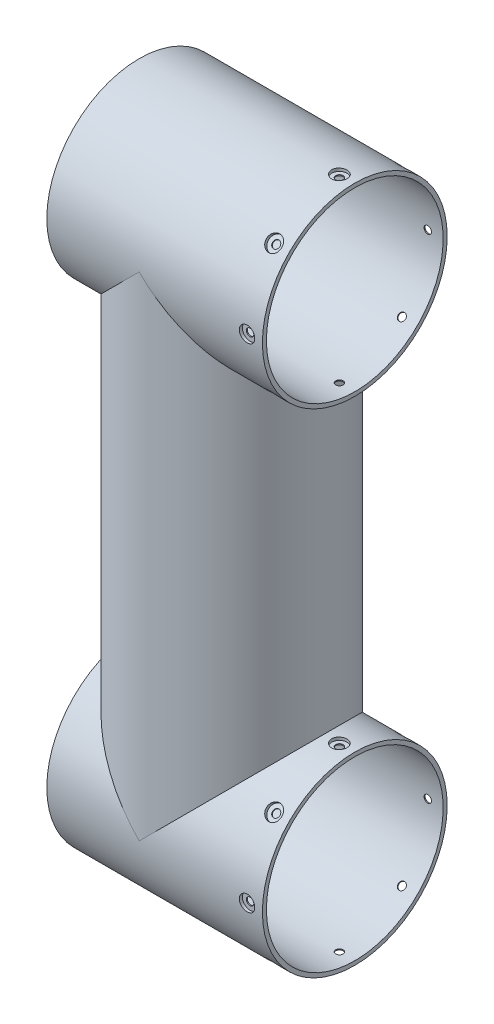
from build123d import *
from build123d.topology import SkipClean

# Parameters (mm, degrees)
SKETCH_1_R               = 30
EXTRUDE_1_DEPTH          = 160
EXTRUDE_START            = -30
SKETCH_2_R               = 30
EXTRUDE_2_DEPTH          = 70
SKETCH_3_R               = 28.7
CUT_EXTRUDE_1_DEPTH      = 178.200451467
SKETCH_4_R               = 28.7
CUT_EXTRUDE_2_DEPTH      = 160
PATTERN_CIRCULAR_1_COUNT = 8


with BuildPart() as part:
    # 스케치1 → 보스-돌출1 (new body)
    with BuildSketch(Plane(origin=(0, 0, 0), x_dir=(1, 0, 0), z_dir=(0, 1, 0))):
        Circle(SKETCH_1_R)
    extrude(amount=EXTRUDE_1_DEPTH)

    # 스케치2 → 보스-돌출2 (add)
    with SkipClean():  # the faces are left unmerged after this step: merging them gives an invalid solid
        with BuildSketch(Plane(origin=(0, 0, 0), x_dir=(0, 0, -1), z_dir=(1, 0, 0)).offset(EXTRUDE_START)):
            Circle(SKETCH_2_R)
        extrude_2 = extrude(amount=EXTRUDE_2_DEPTH)

    # 스케치3 → 컷-돌출1 (cut, through all)
    with SkipClean():  # the faces are left unmerged after this step: merging them gives an invalid solid
        with BuildSketch(Plane.ZY.offset(30)):
            Circle(SKETCH_3_R)
        cut_extrude_1 = extrude(amount=-CUT_EXTRUDE_1_DEPTH, mode=Mode.SUBTRACT)

    # 스케치4 → 컷-돌출2 (cut)
    with SkipClean():  # the faces are left unmerged after this step: merging them gives an invalid solid
        with BuildSketch(Plane(origin=(0, 160, 0), x_dir=(1, 0, 0), z_dir=(0, 1, 0))):
            Circle(SKETCH_4_R)
        extrude(amount=-CUT_EXTRUDE_2_DEPTH, mode=Mode.SUBTRACT)

    # 스케치7 → M2 남비 머리 나사용 카운터보어1 (revolve, cut)
    with SkipClean():  # the faces are left unmerged after this step: merging them gives an invalid solid
        with BuildSketch(Plane(origin=(35, 0, -30), x_dir=(0, 1, 0), z_dir=(1, 0, 0))):
            Polygon((0, 0), (0, 10.721032743), (1.2, 10), (1.2, 1), (2.5, 1), (2.5, 0), align=None)
        hole_wizard_m2_1 = revolve(axis=Axis((35, 0, -36.35), (0, 0, 1)), mode=Mode.SUBTRACT)

    # 원형 패턴1: M2 남비 머리 나사용 카운터보어1 ×8 about axis
    with SkipClean():  # the faces are left unmerged after this step: merging them gives an invalid solid
        pattern_circular_1_axis = Axis((40, 0, 0), (1, 0, 0))
        for i in range(1, PATTERN_CIRCULAR_1_COUNT):
            add(hole_wizard_m2_1.rotate(pattern_circular_1_axis, i * 360 / PATTERN_CIRCULAR_1_COUNT), mode=Mode.SUBTRACT)

    # 대칭 복사2: 보스-돌출2, 컷-돌출1, M2 남비 머리 나사용 카운터보어1 across plane
    with SkipClean():  # the faces are left unmerged after this step: merging them gives an invalid solid
        add(extrude_2.mirror(Plane.ZX.offset(80)))
        add(cut_extrude_1.mirror(Plane.ZX.offset(80)), mode=Mode.SUBTRACT)
        add(hole_wizard_m2_1.mirror(Plane.ZX.offset(80)), mode=Mode.SUBTRACT)

    # 대칭 복사2 copy 1 sketch → 대칭 복사2 copy 1 (revolve, cut)
    with SkipClean():  # the faces are left unmerged after this step: merging them gives an invalid solid
        with BuildSketch(Plane(origin=(35, 138.786796564, -21.213203436), x_dir=(0, -0.7071067811865476, 0.7071067811865475), z_dir=(1, 0, 0))):
            Polygon((0, 0), (0, -10.721032743), (1.2, -10), (1.2, -1), (2.5, -1), (2.5, 0), align=None)
        revolve(axis=Axis((35, 134.296668504, -25.703331496), (0, -0.7071067811865475, -0.7071067811865476)), mode=Mode.SUBTRACT)

    # 대칭 복사2 copy 2 sketch → 대칭 복사2 copy 2 (revolve, cut)
    with SkipClean():  # the faces are left unmerged after this step: merging them gives an invalid solid
        with BuildSketch(Plane(origin=(35, 130, 0), x_dir=(0, 0, 1), z_dir=(1, 0, 0))):
            Polygon((0, 0), (0, -10.721032743), (1.2, -10), (1.2, -1), (2.5, -1), (2.5, 0), align=None)
        revolve(axis=Axis((35, 123.65, 0), (0, -1, 0)), mode=Mode.SUBTRACT)

    # 대칭 복사2 copy 3 sketch → 대칭 복사2 copy 3 (revolve, cut)
    with SkipClean():  # the faces are left unmerged after this step: merging them gives an invalid solid
        with BuildSketch(Plane(origin=(35, 138.786796564, 21.213203436), x_dir=(0, 0.7071067811865475, 0.7071067811865476), z_dir=(1, 0, 0))):
            Polygon((0, 0), (0, -10.721032743), (1.2, -10), (1.2, -1), (2.5, -1), (2.5, 0), align=None)
        revolve(axis=Axis((35, 134.296668504, 25.703331496), (0, -0.7071067811865476, 0.7071067811865475)), mode=Mode.SUBTRACT)

    # 대칭 복사2 copy 4 sketch → 대칭 복사2 copy 4 (revolve, cut)
    with SkipClean():  # the faces are left unmerged after this step: merging them gives an invalid solid
        with BuildSketch(Plane(origin=(35, 160, 30), x_dir=(0, 1, 0), z_dir=(1, 0, 0))):
            Polygon((0, 0), (0, -10.721032743), (1.2, -10), (1.2, -1), (2.5, -1), (2.5, 0), align=None)
        revolve(axis=Axis((35, 160, 36.35), (0, 0, 1)), mode=Mode.SUBTRACT)

    # 대칭 복사2 copy 5 sketch → 대칭 복사2 copy 5 (revolve, cut)
    with SkipClean():  # the faces are left unmerged after this step: merging them gives an invalid solid
        with BuildSketch(Plane(origin=(35, 181.213203436, 21.213203436), x_dir=(0, 0.7071067811865477, -0.7071067811865475), z_dir=(1, 0, 0))):
            Polygon((0, 0), (0, -10.721032743), (1.2, -10), (1.2, -1), (2.5, -1), (2.5, 0), align=None)
        revolve(axis=Axis((35, 185.703331496, 25.703331496), (0, 0.7071067811865475, 0.7071067811865477)), mode=Mode.SUBTRACT)

    # 대칭 복사2 copy 6 sketch → 대칭 복사2 copy 6 (revolve, cut)
    with SkipClean():  # the faces are left unmerged after this step: merging them gives an invalid solid
        with BuildSketch(Plane(origin=(35, 190, 0), x_dir=(0, 0, -1), z_dir=(1, 0, 0))):
            Polygon((0, 0), (0, -10.721032743), (1.2, -10), (1.2, -1), (2.5, -1), (2.5, 0), align=None)
        revolve(axis=Axis((35, 196.35, 0), (0, 1, 0)), mode=Mode.SUBTRACT)

    # 대칭 복사2 copy 7 sketch → 대칭 복사2 copy 7 (revolve, cut)
    with SkipClean():  # the faces are left unmerged after this step: merging them gives an invalid solid
        with BuildSketch(Plane(origin=(35, 181.213203436, -21.213203436), x_dir=(0, -0.7071067811865474, -0.7071067811865477), z_dir=(1, 0, 0))):
            Polygon((0, 0), (0, -10.721032743), (1.2, -10), (1.2, -1), (2.5, -1), (2.5, 0), align=None)
        revolve(axis=Axis((35, 185.703331496, -25.703331496), (0, 0.7071067811865477, -0.7071067811865474)), mode=Mode.SUBTRACT)


solid = part.part
